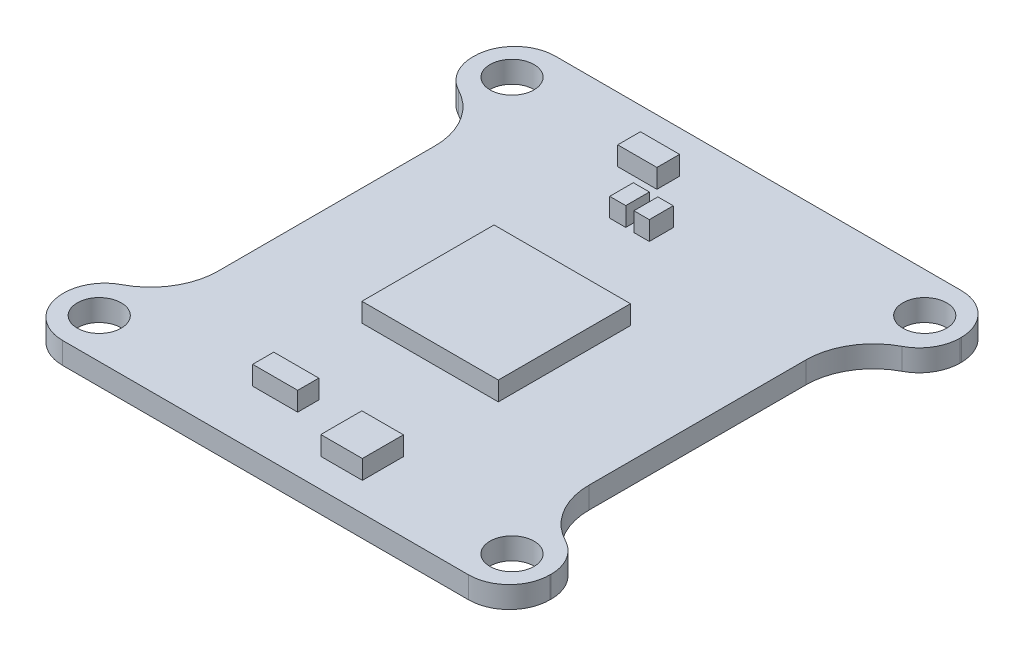
from build123d import *

# Parameters (mm, degrees)
SKETCH1_R            = 1.625
PCB_DEPTH            = 1.6
SKETCH2_W            = 10.080807645
SKETCH2_H            = 9.766872459
SKETCH2_W_2          = 3.069588487
SKETCH2_H_2          = 3.0347068
SKETCH2_W_3          = 2.89518005
SKETCH2_H_3          = 1.674320993
SKETCH2_W_4          = 1.18597737
SKETCH2_H_4          = 1.744084367
SKETCH2_W_5          = 1.137538121
SKETCH2_H_5          = 1.77179178
SKETCH2_W_6          = 3.325937142
SKETCH2_H_6          = 1.560165557
TOP_COMPONENTS_DEPTH = 1.4
FILLET1_R            = 3
FILLET2_R            = 5
SKETCH3_W            = 3.174233549
SKETCH3_H            = 2.964943425
SKETCH3_W_2          = 3.104470174
SKETCH3_H_2          = 1.534794244
SKETCH3_W_3          = 2.999825112
SKETCH3_H_3          = 1.569675931
SKETCH3_W_4          = 1.255740744
SKETCH3_H_4          = 2.895180051
SKETCH3_W_5          = 1.151095683
SKETCH3_H_5          = 2.058019554
BOSS_EXTRUDE3_DEPTH  = 1.4


with BuildPart() as part:
    # Sketch1 → PCB (new body)
    with BuildSketch(Plane(origin=(0, 0, 0), x_dir=(1, 0, 0), z_dir=(0, 1, 0))):
        Polygon((-18, 18.2), (-18, 12.1), (-13.7, 12.1), (-13.7, -12.1), (-18, -12.1), (-18, -18.2), (18, -18.2), (18, -12.1), (13.7, -12.1), (13.7, 12.1), (18, 12.1), (18, 18.2), align=None)
        with Locations((-15.25, 15.25)):
            Circle(SKETCH1_R, mode=Mode.SUBTRACT)
        with Locations((15.25, 15.25)):
            Circle(SKETCH1_R, mode=Mode.SUBTRACT)
        with Locations((15.25, -15.25)):
            Circle(SKETCH1_R, mode=Mode.SUBTRACT)
        with Locations((-15.25, -15.25)):
            Circle(SKETCH1_R, mode=Mode.SUBTRACT)
    extrude(amount=PCB_DEPTH)

    # Sketch2 → Top components (add)
    with BuildSketch(Plane(origin=(0, 1.6, 0), x_dir=(1, 0, 0), z_dir=(0, 1, 0))):
        with Locations((-0.017440844, -1.151095683)):
            Rectangle(SKETCH2_W, SKETCH2_H)
        with Locations((3.488168735, -14.56310447)):
            Rectangle(SKETCH2_W_2, SKETCH2_H_2)
        with Locations((-4.168361639, 14.266610128)):
            Rectangle(SKETCH2_W_3, SKETCH2_H_3)
        with Locations((-2.023137867, 10.708678018)):
            Rectangle(SKETCH2_W_4, SKETCH2_H_4)
        with Locations((-0.233509749, 10.694824311)):
            Rectangle(SKETCH2_W_5, SKETCH2_H_5)
        with Locations((-3.394876095, -13.324858297)):
            Rectangle(SKETCH2_W_6, SKETCH2_H_6)
    extrude(amount=TOP_COMPONENTS_DEPTH)

    # Fillet1
    fillet1_edges = [part.edges().sort_by_distance(p)[0] for p in [
        (-18, 0.8, 12.1),
        (-18, 0.8, -12.1),
        (18, 0.8, -12.1),
        (18, 0.8, 12.1),
        (18, 0.8, 18.2),
        (-18, 0.8, 18.2),
        (-18, 0.8, -18.2),
        (18, 0.8, -18.2),
    ]]
    fillet(fillet1_edges, radius=FILLET1_R)

    # Fillet2
    fillet2_edges = [part.edges().sort_by_distance(p)[0] for p in [
        (13.7, 0.8, -12.1),
        (13.7, 0.8, 12.1),
        (-13.7, 0.8, 12.1),
        (-13.7, 0.8, -12.1),
    ]]
    fillet(fillet2_edges, radius=FILLET2_R)

    # Sketch3 → Boss-Extrude3 (add)
    with BuildSketch(Plane.XZ):
        with Locations((-8.319282433, -14.318932658)):
            Rectangle(SKETCH3_W, SKETCH3_H)
        with Locations((-4.307888388, -14.127083378)):
            Rectangle(SKETCH3_W_2, SKETCH3_H_2)
        with Locations((3.662577172, 9.540141492)):
            Rectangle(SKETCH3_W_3, SKETCH3_H_3)
        with Locations((-4.150920795, 9.470378117)):
            Rectangle(SKETCH3_W_4, SKETCH3_H_4)
        with Locations((-1.552235088, -14.388696033)):
            Rectangle(SKETCH3_W_5, SKETCH3_H_5)
    extrude(amount=BOSS_EXTRUDE3_DEPTH)


solid = part.part
